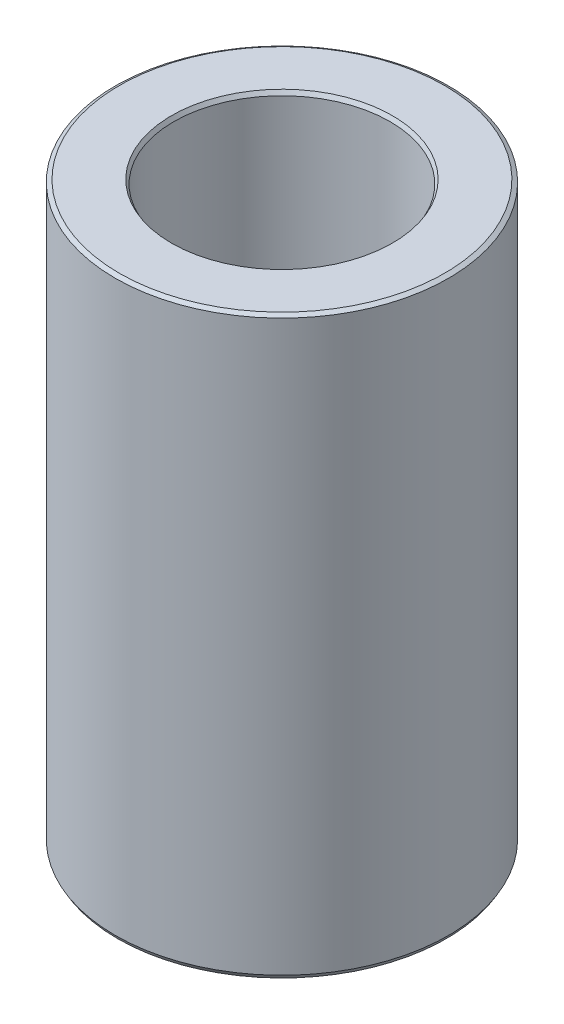
from build123d import *
from OCP.BRepFilletAPI import BRepFilletAPI_MakeChamfer

# Parameters (mm, degrees)
SKETCH1_R           = 55
BOSS_EXTRUDE1_DEPTH = 189.913354494
SKETCH2_R           = 35.688619668
CUT_EXTRUDE1_DEPTH  = 206.224467876
CHAMFER1_SIZE       = 0.766565949
CHAMFER1_SIZE2      = 1.327731171


with BuildPart() as part:
    # Sketch1 → Boss-Extrude1 (new body)
    with BuildSketch(Plane(origin=(0, 0, 0), x_dir=(1, 0, 0), z_dir=(0, 1, 0))):
        Circle(SKETCH1_R)
    extrude(amount=BOSS_EXTRUDE1_DEPTH)

    # Sketch2 → Cut-Extrude1 (cut, through all)
    with BuildSketch(Plane(origin=(0, 0, 0), x_dir=(1, 0, 0), z_dir=(0, 1, 0))):
        Circle(SKETCH2_R)
    extrude(amount=CUT_EXTRUDE1_DEPTH, mode=Mode.SUBTRACT)

    # Chamfer1: one chamfer whose edges measure the first distance from different faces: ONE call of the kernel's chamfer builder (chamfer() names one face for all edges)
    chamfer1_edges_1 = [part.edges().sort_by_distance(p)[0] for p in [
        (-35.688619668, 189.913354494, 0),
    ]]
    chamfer1_side_1 = [part.faces().sort_by_distance(p)[0] for p in [
        (-53.444365081, 189.913354494, 0),
    ]]
    chamfer1_edges_2 = [part.edges().sort_by_distance(p)[0] for p in [
        (-35.688619668, 0, 0),
    ]]
    chamfer1_side_2 = [part.faces().sort_by_distance(p)[0] for p in [
        (-35.688619668, 94.956677247, 0),
    ]]
    chamfer1_edges_3 = [part.edges().sort_by_distance(p)[0] for p in [
        (-55, 0, 0),
    ]]
    chamfer1_side_3 = [part.faces().sort_by_distance(p)[0] for p in [
        (-53.444365081, 0, 0),
    ]]
    chamfer1_edges_4 = [part.edges().sort_by_distance(p)[0] for p in [
        (-55, 189.913354494, 0),
    ]]
    chamfer1_side_4 = [part.faces().sort_by_distance(p)[0] for p in [
        (-55, 94.956677247, 0),
    ]]
    chamfer1 = BRepFilletAPI_MakeChamfer(part.part.solid().wrapped)
    for e in chamfer1_edges_1:
        chamfer1.Add(CHAMFER1_SIZE, CHAMFER1_SIZE2, e.wrapped, chamfer1_side_1[0].wrapped)  # the first distance lies on this face
    for e in chamfer1_edges_2:
        chamfer1.Add(CHAMFER1_SIZE, CHAMFER1_SIZE2, e.wrapped, chamfer1_side_2[0].wrapped)  # the first distance lies on this face
    for e in chamfer1_edges_3:
        chamfer1.Add(CHAMFER1_SIZE, CHAMFER1_SIZE2, e.wrapped, chamfer1_side_3[0].wrapped)  # the first distance lies on this face
    for e in chamfer1_edges_4:
        chamfer1.Add(CHAMFER1_SIZE, CHAMFER1_SIZE2, e.wrapped, chamfer1_side_4[0].wrapped)  # the first distance lies on this face
    add(Compound.cast(chamfer1.Shape()), mode=Mode.REPLACE)


solid = part.part
